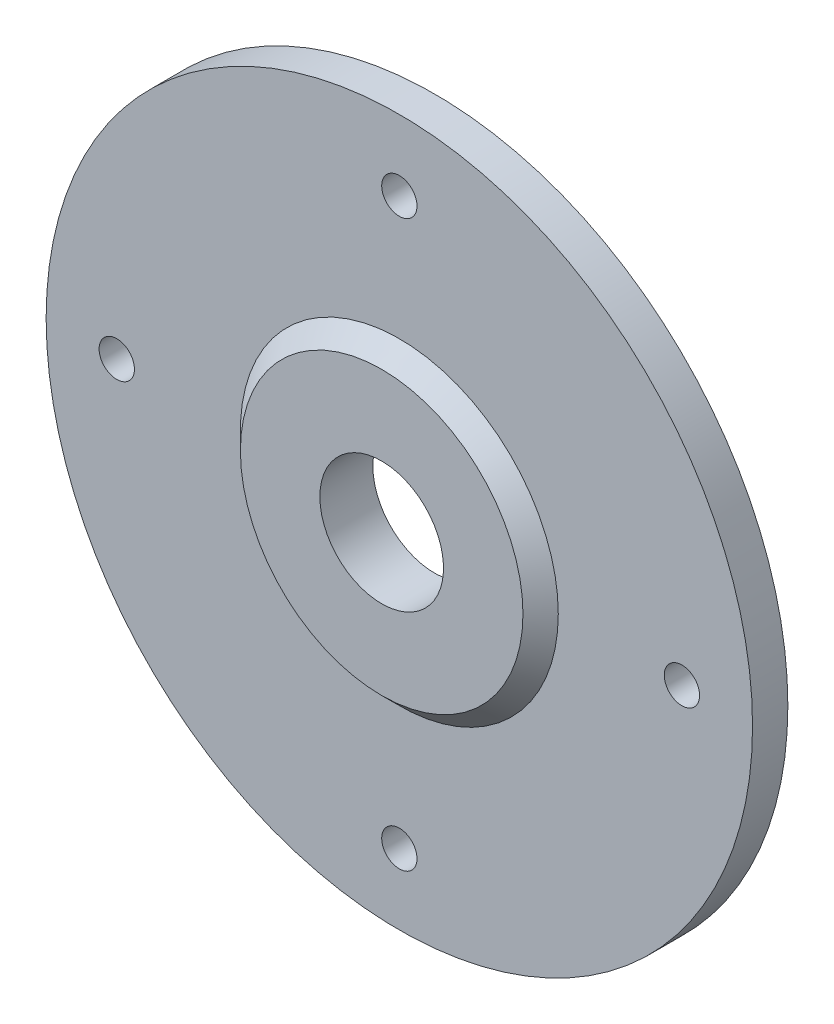
from build123d import *

# Parameters (mm, degrees)
SKETCH_1_R          = 10
EXTRUDE_1_DEPTH     = 1
SKETCH_2_R          = 4.5
EXTRUDE_2_DEPTH     = 0.5
CHAMFER_1_SIZE      = 0.5
SKETCH_3_R          = 1.75
CUT_EXTRUDE_1_DEPTH = 15.221462653
SKETCH_4_R          = 0.5
CUT_EXTRUDE_2_DEPTH = 15.221462653


with BuildPart() as part:
    # 草图1 → 凸台-拉伸1 (new body)
    with BuildSketch(Plane.XY):
        Circle(SKETCH_1_R)
    extrude(amount=EXTRUDE_1_DEPTH)

    # 草图2 → 凸台-拉伸2 (add)
    with BuildSketch(Plane.XY.offset(1)):
        Circle(SKETCH_2_R)
    extrude(amount=EXTRUDE_2_DEPTH)

    # 倒角1
    chamfer_1_edges = [part.edges().sort_by_distance(p)[0] for p in [
        (-4.5, 0, 1.5),
    ]]
    chamfer(chamfer_1_edges, length=CHAMFER_1_SIZE - 0.0001)  # a hair under: the kernel refuses the full size

    # 草图3 → 切除-拉伸1 (cut, through all)
    with BuildSketch(Plane(origin=(0, 0, 0), x_dir=(-1, 0, 0), z_dir=(0, 0, -1))):
        Circle(SKETCH_3_R)
    extrude(amount=-CUT_EXTRUDE_1_DEPTH, mode=Mode.SUBTRACT)

    # 草图4 → 切除-拉伸2 (cut, through all)
    with BuildSketch(Plane(origin=(0, 0, 0), x_dir=(-1, 0, 0), z_dir=(0, 0, -1))):
        with Locations((0, 8)):
            Circle(SKETCH_4_R)
        with Locations((8, 0)):
            Circle(SKETCH_4_R)
        with Locations((0, -8)):
            Circle(SKETCH_4_R)
        with Locations((-8, 0)):
            Circle(SKETCH_4_R)
    extrude(amount=-CUT_EXTRUDE_2_DEPTH, mode=Mode.SUBTRACT)


solid = part.part
